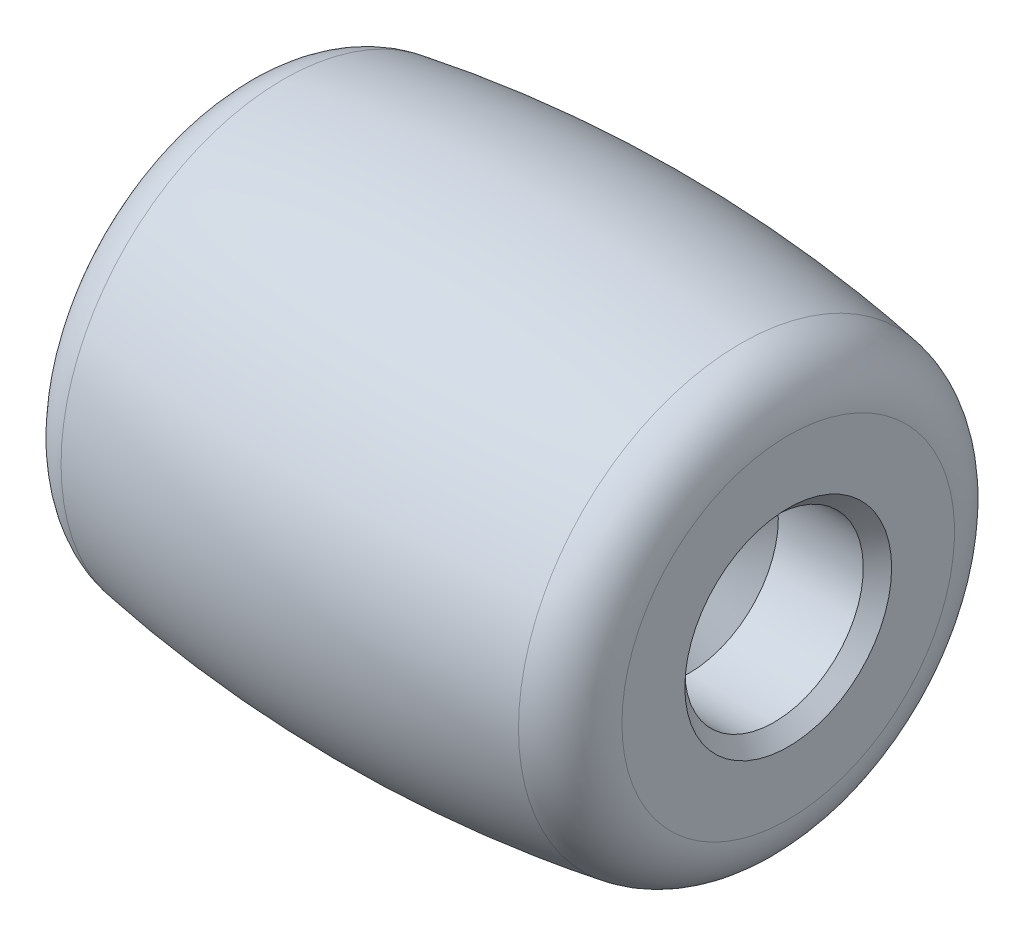
from build123d import *

# Parameters (mm, degrees)
SKETCH3_W            = 6
SKETCH3_H            = 3.15
FILLET1_R            = 2
FILLET1_OF_MIRROR1_R = 2
CHAMFER2_SIZE        = 0.5
CHAMFER3_SIZE        = 3
CHAMFER3_SIZE_2      = 2.5


# Read off the part's stored shape, not the designer's step: Mirror5
with BuildPart() as part:
    # Sketch1 → Revolve2 (revolve)
    with BuildSketch(Plane.XY, mode=Mode.PRIVATE) as revolve2_sk:
        with BuildLine():
            Line((0, 1.75), (9.75, 1.75))
            Line((9.75, 1.75), (9.75, 7.540162112))
            ThreePointArc((9.75, 7.540162112), (4.89856583, 8.259461943), (0, 8.5))
            Line((0, 8.5), (0, 1.75))
        make_face()
    revolve2 = revolve(revolve2_sk.sketch.rotate(Axis((0, 0, 0), (1, 0, 0)), 90), axis=Axis((0, 0, 0), (1, 0, 0)))

    # Sketch3 → Cut-Revolve1 (revolve, cut)
    with BuildSketch(Plane.XY, mode=Mode.PRIVATE) as cut_revolve1_sk:
        with Locations((6.75, 1.575)):
            Rectangle(SKETCH3_W, SKETCH3_H)
    revolve(cut_revolve1_sk.sketch.rotate(Axis((3.75, 0, 0), (-1, 0, 0)), 270), axis=Axis((3.75, 0, 0), (-1, 0, 0)), mode=Mode.SUBTRACT)

    # Fillet1
    fillet1_edges = [part.edges().sort_by_distance(p)[0] for p in [
        (9.75, 0, -7.540162112),
    ]]
    fillet(fillet1_edges, radius=FILLET1_R)

    # Mirror1: Revolve2 across plane
    add(revolve2.mirror(Plane(origin=(0, 0, 0), x_dir=(0, 0, 1), z_dir=(1, 0, 0))))

    # Fillet1 of Mirror1
    fillet1_of_mirror1_edges = [part.edges().sort_by_distance(p)[0] for p in [
        (-9.75, 0, -7.540162112),
    ]]
    fillet(fillet1_of_mirror1_edges, radius=FILLET1_OF_MIRROR1_R)

    # Chamfer2
    chamfer2_edges = [part.edges().sort_by_distance(p)[0] for p in [
        (9.75, 0, -3.15),
    ]]
    chamfer(chamfer2_edges, length=CHAMFER2_SIZE)

    # Mirror5 outline → Mirror5 (revolve, cut)
    with BuildSketch(Plane.YX):
        Polygon((3.15, -9.25), (3.15, -3.75), (1.75, -3.75), (1.75, -9.75), (3.65, -9.75), align=None)
    revolve(axis=Axis((0, 0, 0), (1, 0, 0)), mode=Mode.SUBTRACT)

    # Chamfer3
    # the kernel refuses this chamfer: 3, 2.5 mm, written as the material it adds along each edge
    with BuildSketch(Plane(origin=(-3.75, 0, 0), x_dir=(0, 1, 0), z_dir=(0, 0, -1))) as chamfer3_piece_1_section:
        Polygon((3.15, -CHAMFER3_SIZE), (3.15 - CHAMFER3_SIZE_2, 0), (3.15, 0), align=None)
    chamfer3_piece_1 = revolve(axis=Axis((-3.75, 0, 0), (1, 0, 0)), mode=Mode.PRIVATE)
    chamfer3_piece_1 = chamfer3_piece_1 - Plane(origin=(-5.931911747, 0, 0), x_dir=(0, 0, 1), z_dir=(1, 0, 0)) * Cylinder(1.75, 13, mode=Mode.PRIVATE)
    add(chamfer3_piece_1)
    with BuildSketch(Plane(origin=(3.75, 0, 0), x_dir=(0, 0, 1), z_dir=(0, -1, 0))) as chamfer3_piece_2_section:
        Polygon((3.15 - CHAMFER3_SIZE, 0), (3.15, -CHAMFER3_SIZE_2), (3.15, 0), align=None)
    chamfer3_piece_2 = revolve(axis=Axis((3.75, 0, 0), (-1, 0, 0)), mode=Mode.PRIVATE)
    chamfer3_piece_2 = chamfer3_piece_2 - Plane(origin=(5.677253333, 0, 0), x_dir=(0, 0, 1), z_dir=(1, 0, 0)) * Cylinder(1.75, 13, mode=Mode.PRIVATE)
    add(chamfer3_piece_2)


solid = part.part
